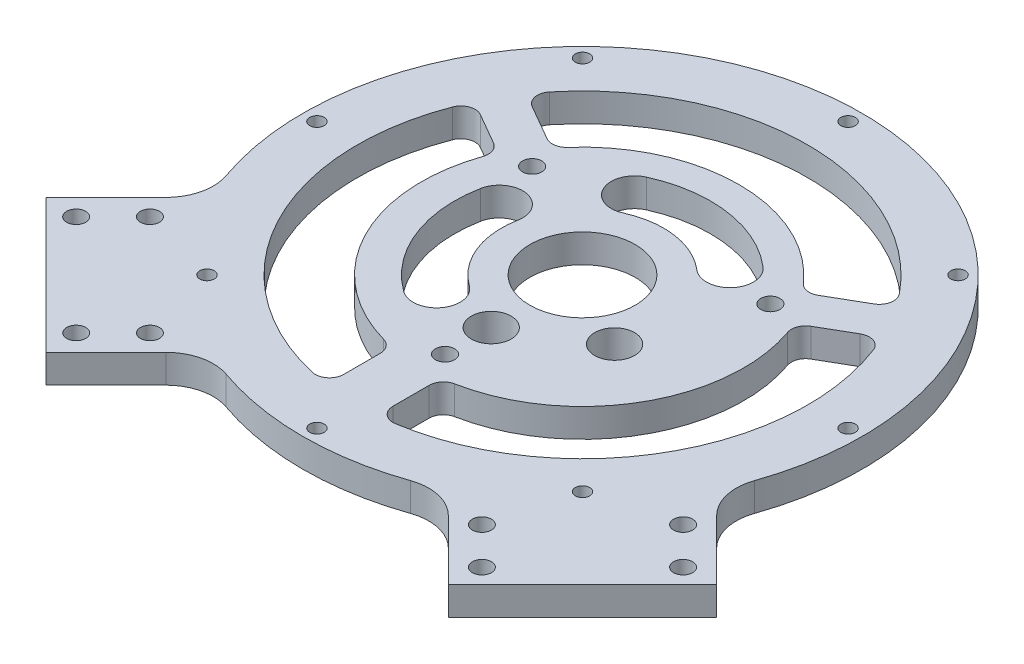
from build123d import *
from build123d.topology import SkipClean

# Parameters (mm, degrees)
SKETCH_1_R               = 59
SKETCH_1_R_2             = 11.1
EXTRUDE_1_DEPTH          = 6
SKETCH_2_R               = 1.525
CUT_EXTRUDE_1_DEPTH      = 6
EXTRUDE_START            = -6
EXTRUDE_2_DEPTH          = 6
SKETCH_4_R               = 4.2
SKETCH_4_R_2             = 2.025
CUT_EXTRUDE_2_DEPTH      = 6
SKETCH_5_R               = 4.2
CUT_EXTRUDE_3_DEPTH      = 6
CUT_EXTRUDE_4_DEPTH      = 10
CUT_EXTRUDE_5_DEPTH      = 10
CUT_EXTRUDE_7_DEPTH      = 10
FILLET_1_R               = 3
SKETCH_11_R              = 2.5
CUT_EXTRUDE_8_DEPTH      = 10
CUT_EXTRUDE_9_DEPTH      = 10
PATTERN_CIRCULAR_1_COUNT = 3
CUT_EXTRUDE_10_DEPTH     = 20
FILLET_3_R               = 20
FILLET_4_R               = 2
EXTRUDE_3_DEPTH          = 6
SKETCH_17_R              = 2.5
CUT_EXTRUDE_11_DEPTH     = 6
FILLET_5_R               = 20
EXTRUDE_4_DEPTH          = 6
MOVE_START               = -1
MOVE_FACE_1_OUTLINE_R    = 2.5
MOVE_FACE_1_DEPTH        = 8
MOVE_FACE_1_2_OUTLINE_R  = 2.5
MOVE_FACE_1_2_DEPTH      = 6
MOVE_FACE_2_OUTLINE_R    = 2.5
MOVE_FACE_2_DEPTH        = 8
MOVE_FACE_2_2_OUTLINE_R  = 2.5
MOVE_FACE_2_2_DEPTH      = 6
CUT_EXTRUDE_12_DEPTH     = 6
SKETCH_22_W              = 27
SKETCH_22_H              = 27
CUT_EXTRUDE_13_DEPTH     = 6
CHAMFER_1_SIZE           = 10
CHAMFER_1_SIZE_2         = 8.996196186
CHAMFER_2_SIZE           = 10
CHAMFER_3_SIZE           = 5
FILLET_6_R               = 5
FILLET_7_R               = 5
SKETCH_23_W              = 40
SKETCH_23_H              = 20
SKETCH_23_R              = 2.01
EXTRUDE_5_DEPTH          = 6
CUT_EXTRUDE_14_DEPTH     = 10
EXTRUDE_6_DEPTH          = 6
CUT_EXTRUDE_15_DEPTH     = 10
EXTRUDE_7_DEPTH          = 6
EXTRUDE_7_2_DEPTH        = 6
SKETCH_30_R              = 2.01
CUT_EXTRUDE_16_DEPTH     = 6
MOVE_BODY_2_ANGLE        = 90
EXTRUDE_9_DEPTH          = 6
FILLET_8_R               = 10


with BuildPart() as part:
    # 草图1 → 凸台-拉伸1 (new body)
    with BuildSketch(Plane(origin=(0, 0, 0), x_dir=(1, 0, 0), z_dir=(0, 1, 0))):
        with Locations(Location((0, 0, 0), (0, 0, 270))):
            Circle(SKETCH_1_R)
        with Locations(Location((0, 0, 0), (0, 0, 270))):
            Circle(SKETCH_1_R_2, mode=Mode.SUBTRACT)
    extrude(amount=EXTRUDE_1_DEPTH)

    # 草图2 → 切除-拉伸1 (cut)
    with BuildSketch(Plane(origin=(0, 6, 0), x_dir=(1, 0, 0), z_dir=(0, 1, 0))):
        with Locations(Location((0, 56, 0), (0, 0, 270))):
            Circle(SKETCH_2_R)
        with Locations(Location((39.597979746, 39.597979746, 0), (0, 0, 270))):
            Circle(SKETCH_2_R)
        with Locations(Location((56, 0, 0), (0, 0, 270))):
            Circle(SKETCH_2_R)
        with Locations(Location((39.597979746, -39.597979746, 0), (0, 0, 270))):
            Circle(SKETCH_2_R)
        with Locations(Location((0, -56, 0), (0, 0, 270))):
            Circle(SKETCH_2_R)
        with Locations(Location((-39.597979746, -39.597979746, 0), (0, 0, 270))):
            Circle(SKETCH_2_R)
        with Locations(Location((-56, 0, 0), (0, 0, 270))):
            Circle(SKETCH_2_R)
        with Locations(Location((-39.597979746, 39.597979746, 0), (0, 0, 270))):
            Circle(SKETCH_2_R)
    extrude(amount=-CUT_EXTRUDE_1_DEPTH, mode=Mode.SUBTRACT)

    # 草图3 → 凸台-拉伸2 (add)
    with BuildSketch(Plane(origin=(0, 6, 0), x_dir=(1, 0, 0), z_dir=(0, 1, 0)).offset(EXTRUDE_START)):
        with BuildLine():
            Line((-51.088050573, 29.512896989), (-22.5, 79))
            Line((-22.5, 79), (22.5, 79))
            Line((22.5, 79), (51.088050573, 29.512896989))
            ThreePointArc((51.088050573, 29.512896989), (0, 59), (-51.088050573, 29.512896989))
        make_face()
    extrude(amount=EXTRUDE_2_DEPTH)

    # 草图4 → 切除-拉伸2 (cut)
    with BuildSketch(Plane.XZ):
        with Locations(Location((0, 19.25, 0), (0, 0, 270))):
            Circle(SKETCH_4_R)
        with Locations(Location((0, 29, 0), (0, 0, 270))):
            Circle(SKETCH_4_R_2)
        with Locations(Location((25.11473671, -14.5, 0), (0, 0, 270))):
            Circle(SKETCH_4_R_2)
        with Locations(Location((-25.11473671, -14.5, 0), (0, 0, 270))):
            Circle(SKETCH_4_R_2)
    extrude(amount=-CUT_EXTRUDE_2_DEPTH, mode=Mode.SUBTRACT)

    # 草图5 → 切除-拉伸3 (cut)
    with BuildSketch(Plane.XZ):
        with Locations(Location((16.02146997, 9.25, 0), (0, 0, 270))):
            Circle(SKETCH_5_R)
    extrude(amount=-CUT_EXTRUDE_3_DEPTH, mode=Mode.SUBTRACT)

    # 草图8 → 切除-拉伸4 (cut)
    with BuildSketch(Plane.XZ):
        with BuildLine():
            Line((38.990090266, -27.129741264), (26.368115905, -19.842440969))
            ThreePointArc((26.368115905, -19.842440969), (0, -33), (-26.368115905, -19.842440969))
            Line((-26.368115905, -19.842440969), (-38.990090266, -27.129741264))
            ThreePointArc((-38.990090266, -27.129741264), (0, -47.5), (38.990090266, -27.129741264))
        make_face()
    extrude(amount=-CUT_EXTRUDE_4_DEPTH, mode=Mode.SUBTRACT)

    # 草图9 → 切除-拉伸5 (cut)
    with BuildSketch(Plane.XZ):
        with BuildLine():
            ThreePointArc((34, 0), (33.302950494, -6.849342188), (31.240383034, -13.417841401))
            Line((31.240383034, -13.417841401), (42.990090266, -20.201538034))
            ThreePointArc((42.990090266, -20.201538034), (46.35881409, -10.349413326), (47.5, 0))
            ThreePointArc((47.5, 0), (34.973204028, 32.142261899), (4, 47.331279298))
            Line((4, 47.331279298), (4, 33.763886032))
            ThreePointArc((4, 33.763886032), (25.416530054, 22.583179581), (34, 0))
        make_face()
    extrude(amount=-CUT_EXTRUDE_5_DEPTH, mode=Mode.SUBTRACT)

    # 草图10 → 切除-拉伸7 (cut)
    with BuildSketch(Plane.XZ):
        with BuildLine():
            Line((-42.990090266, -20.201538034), (-31.240383034, -13.417841401))
            ThreePointArc((-31.240383034, -13.417841401), (-30.175452448, 15.666590872), (-7, 33.271609519))
            Line((-7, 33.271609519), (-7, 46.98137929))
            ThreePointArc((-7, 46.98137929), (-41.870495295, 22.430149883), (-42.990090266, -20.201538034))
        make_face()
    extrude(amount=-CUT_EXTRUDE_7_DEPTH, mode=Mode.SUBTRACT)

    # 圆角1
    fillet_1_edges = [part.edges().sort_by_distance(p)[0] for p in [
        (42.990090266, 3, -20.201538034),
        (31.240383034, 3, -13.417841401),
        (4, 3, 33.763886032),
        (4, 3, 47.331279298),
        (-7, 3, 46.98137929),
        (-7, 3, 33.271609519),
        (-31.240383034, 3, -13.417841401),
        (-42.990090266, 3, -20.201538034),
        (-26.368115905, 3, -19.842440969),
        (26.368115905, 3, -19.842440969),
        (38.990090266, 3, -27.129741264),
        (-38.990090266, 3, -27.129741264),
    ]]
    fillet(fillet_1_edges, radius=FILLET_1_R)

    # 草图11 → 切除-拉伸8 (cut)
    with BuildSketch(Plane(origin=(0, 6, 0), x_dir=(1, 0, 0), z_dir=(0, 1, 0))):
        with Locations(Location((15, 63, 0), (0, 0, 270))):
            Circle(SKETCH_11_R)
        with Locations(Location((15, 74, 0), (0, 0, 270))):
            Circle(SKETCH_11_R)
        with Locations(Location((-15, 63, 0), (0, 0, 270))):
            Circle(SKETCH_11_R)
        with Locations(Location((-15, 74, 0), (0, 0, 270))):
            Circle(SKETCH_11_R)
    extrude(amount=-CUT_EXTRUDE_8_DEPTH, mode=Mode.SUBTRACT)

    # 草图12 → 切除-拉伸9 (cut)
    with BuildSketch(Plane.XZ):
        with BuildLine():
            ThreePointArc((-11.126662137, -24.600759941), (3.851051224, -26.723948145), (17.619884076, -20.458242475))
            ThreePointArc((17.619884076, -20.458242475), (18.140249782, -13.477252607), (11.159259915, -12.956886901))
            ThreePointArc((11.159259915, -12.956886901), (2.438999108, -16.925167159), (-7.04688602, -15.580481296))
            ThreePointArc((-7.04688602, -15.580481296), (-13.596913401, -18.05073256), (-11.126662137, -24.600759941))
        make_face()
    cut_extrude_9 = extrude(amount=-CUT_EXTRUDE_9_DEPTH, mode=Mode.SUBTRACT)

    # 阵列(圆周)1: 切除-拉伸9 ×3 about axis, 1 skipped
    pattern_circular_1_axis = Axis((0, 0, 0), (0, 1, 0))
    add([cut_extrude_9.rotate(pattern_circular_1_axis, i * 360 / PATTERN_CIRCULAR_1_COUNT) for i in range(1, PATTERN_CIRCULAR_1_COUNT) if i not in (2,)], mode=Mode.SUBTRACT)

    # 草图15 → 切除-拉伸10 (cut, symmetric)
    with BuildSketch(Plane.XZ):
        with BuildLine():
            Line((22.5, -79), (22.5, -69))
            Line((22.5, -69), (47.535137175, -34.948687153))
            ThreePointArc((47.535137175, -34.948687153), (49.386437856, -32.279711212), (51.088050573, -29.512896989))
            Line((51.088050573, -29.512896989), (22.5, -79))
        make_face()
        with BuildLine():
            Line((-22.5, -79), (-51.088050573, -29.512896989))
            ThreePointArc((-51.088050573, -29.512896989), (-49.386437856, -32.279711212), (-47.535137175, -34.948687153))
            Line((-47.535137175, -34.948687153), (-22.5, -69))
            Line((-22.5, -69), (-22.5, -79))
        make_face()
    extrude(amount=CUT_EXTRUDE_10_DEPTH, both=True, mode=Mode.SUBTRACT)

    # 圆角3
    fillet_3_edges = [part.edges().sort_by_distance(p)[0] for p in [
        (-22.5, 3, -69),
        (22.5, 3, -69),
    ]]
    fillet(fillet_3_edges, radius=FILLET_3_R)

    # 圆角4
    fillet_4_edges = [part.edges().sort_by_distance(p)[0] for p in [
        (-22.5, 3, -79),
        (22.5, 3, -79),
    ]]
    fillet(fillet_4_edges, radius=FILLET_4_R)

    # 草图16 → 凸台-拉伸3 (add)
    with BuildSketch(Plane.XZ):
        with BuildLine():
            ThreePointArc((-77, 22.5), (-78.414213562, 21.914213562), (-79, 20.5))
            Line((-79, 20.5), (-79, -20.5))
            ThreePointArc((-79, -20.5), (-78.414213562, -21.914213562), (-77, -22.5))
            Line((-77, -22.5), (-75.5609691, -22.5))
            ThreePointArc((-75.5609691, -22.5), (-69.326873995, -23.496419858), (-63.713956506, -26.386394178))
            Line((-63.713956506, -26.386394178), (-42.202213929, -42.202213929))
            Line((-42.202213929, -42.202213929), (-47.535137175, -34.948687153))
            ThreePointArc((-47.535137175, -34.948687153), (-58.324871521, 8.899964162), (-34.948687153, 47.535137175))
            Line((-34.948687153, 47.535137175), (-63.713956506, 26.386394178))
            ThreePointArc((-63.713956506, 26.386394178), (-69.326873995, 23.496419858), (-75.5609691, 22.5))
            Line((-75.5609691, 22.5), (-77, 22.5))
        make_face()
    extrude(amount=-EXTRUDE_3_DEPTH)

    # 草图17 → 切除-拉伸11 (cut)
    with BuildSketch(Plane.XZ):
        with Locations(Location((-74, -15, 0), (0, 0, 270))):
            Circle(SKETCH_17_R)
        with Locations(Location((-63, -15, 0), (0, 0, 270))):
            Circle(SKETCH_17_R)
        with Locations(Location((-74, 15, 0), (0, 0, 270))):
            Circle(SKETCH_17_R)
        with Locations(Location((-63, 15, 0), (0, 0, 270))):
            Circle(SKETCH_17_R)
    extrude(amount=-CUT_EXTRUDE_11_DEPTH, mode=Mode.SUBTRACT)

    # 圆角5
    fillet_5_edges = [part.edges().sort_by_distance(p)[0] for p in [
        (-42.202213929, 3, -42.202213929),
    ]]
    fillet(fillet_5_edges, radius=FILLET_5_R)

    # 草图20 → 凸台-拉伸4 (add)
    with BuildSketch(Plane.XZ.offset(EXTRUDE_START)):
        with BuildLine():
            ThreePointArc((-22.5, -77), (-21.914213562, -78.414213562), (-20.5, -79))
            Line((-20.5, -79), (-79, -79))
            Line((-79, -79), (-79, -20.5))
            ThreePointArc((-79, -20.5), (-78.414213562, -21.914213562), (-77, -22.5))
            Line((-77, -22.5), (-75.5609691, -22.5))
            ThreePointArc((-75.5609691, -22.5), (-69.326873995, -23.496419858), (-63.713956506, -26.386394178))
            Line((-63.713956506, -26.386394178), (-44.661036565, -40.394443337))
            ThreePointArc((-44.661036565, -40.394443337), (-42.365913536, -42.365913536), (-40.394443337, -44.661036565))
            Line((-40.394443337, -44.661036565), (-26.386394178, -63.713956506))
            ThreePointArc((-26.386394178, -63.713956506), (-23.496419858, -69.326873995), (-22.5, -75.5609691))
            Line((-22.5, -75.5609691), (-22.5, -77))
        make_face()
    extrude(amount=EXTRUDE_4_DEPTH)

    # Move Face 1: read off the stored shape, not the designer's step
    # Move Face 1 outline → Move Face 1 (cut)
    with BuildSketch(Plane(origin=(0, 0, 0), x_dir=(1, 0, 0), z_dir=(0, 1, 0)).offset(MOVE_START)):
        with Locations((-45, 74)):
            Circle(MOVE_FACE_1_OUTLINE_R)
        with Locations((-45, 63)):
            Circle(MOVE_FACE_1_OUTLINE_R)
    extrude(amount=MOVE_FACE_1_DEPTH, mode=Mode.SUBTRACT)

    # Move Face 1 2 outline → Move Face 1 2 (add)
    with BuildSketch(Plane(origin=(0, 0, 0), x_dir=(1, 0, 0), z_dir=(0, 1, 0))):
        with Locations((15, 63)):
            Circle(MOVE_FACE_1_2_OUTLINE_R)
        with Locations((15, 74)):
            Circle(MOVE_FACE_1_2_OUTLINE_R)
    extrude(amount=MOVE_FACE_1_2_DEPTH)

    # Move Face 2: read off the stored shape, not the designer's step
    # Move Face 2 outline → Move Face 2 (cut)
    with BuildSketch(Plane(origin=(0, 0, 0), x_dir=(1, 0, 0), z_dir=(0, 1, 0)).offset(MOVE_START)):
        with Locations((-63, 45)):
            Circle(MOVE_FACE_2_OUTLINE_R)
        with Locations((-74, 45)):
            Circle(MOVE_FACE_2_OUTLINE_R)
    extrude(amount=MOVE_FACE_2_DEPTH, mode=Mode.SUBTRACT)

    # Move Face 2 2 outline → Move Face 2 2 (add)
    with BuildSketch(Plane(origin=(0, 0, 0), x_dir=(1, 0, 0), z_dir=(0, 1, 0))):
        with Locations((-74, -15)):
            Circle(MOVE_FACE_2_2_OUTLINE_R)
        with Locations((-63, -15)):
            Circle(MOVE_FACE_2_2_OUTLINE_R)
    extrude(amount=MOVE_FACE_2_2_DEPTH)

    # 草图21 → 切除-拉伸12 (cut)
    with SkipClean():  # the faces are left unmerged after this step: merging them gives an invalid solid
        with BuildSketch(Plane.XZ):
            with BuildLine():
                Line((-79, 20.5), (-79, -7))
                Line((-79, -7), (-58.583274064, -7))
                ThreePointArc((-58.583274064, -7), (-54.134806169, 23.461090364), (-34.948687153, 47.535137175))
                Line((-34.948687153, 47.535137175), (-63.713956506, 26.386394178))
                ThreePointArc((-63.713956506, 26.386394178), (-69.326873995, 23.496419858), (-75.5609691, 22.5))
                Line((-75.5609691, 22.5), (-77, 22.5))
                ThreePointArc((-77, 22.5), (-78.414213562, 21.914213562), (-79, 20.5))
            make_face()
            with BuildLine():
                ThreePointArc((47.535137175, -34.948687153), (23.461090364, -54.134806169), (-7, -58.583274064))
                Line((-7, -58.583274064), (-7, -79))
                Line((-7, -79), (20.5, -79))
                ThreePointArc((20.5, -79), (21.914213562, -78.414213562), (22.5, -77))
                Line((22.5, -77), (22.5, -75.5609691))
                ThreePointArc((22.5, -75.5609691), (23.496419858, -69.326873995), (26.386394178, -63.713956506))
                Line((26.386394178, -63.713956506), (47.535137175, -34.948687153))
            make_face()
        extrude(amount=-CUT_EXTRUDE_12_DEPTH, mode=Mode.SUBTRACT)

    # 草图22 → 切除-拉伸13 (cut)
    with SkipClean():  # the faces are left unmerged after this step: merging them gives an invalid solid
        with BuildSketch(Plane.XZ):
            with Locations((-65.5, -65.5)):
                Rectangle(SKETCH_22_W, SKETCH_22_H)
        extrude(amount=-CUT_EXTRUDE_13_DEPTH, mode=Mode.SUBTRACT)

    # 倒角1
    # the kernel refuses this chamfer: 10, 8.996196186 mm, written as the material it adds along each edge
    with BuildSketch(Plane(origin=(-58.583274064, 0, -7), x_dir=(-0.03705222854815776, 0, 0.9993133304222529), z_dir=(0, 1, 0))) as chamfer_1_piece_1:
        with BuildLine():
            Line((9.649104907, 0), (CHAMFER_1_SIZE * 0.0370522285482, -CHAMFER_1_SIZE * 0.999313330422))
            Line((CHAMFER_1_SIZE * 0.0370522285482, -CHAMFER_1_SIZE * 0.999313330422), (0, 0))
            ThreePointArc((0, 0), (4.961434803, -0.197428902), (9.649104907, 0))
        make_face()
    extrude(amount=6)
    with BuildSketch(Plane(origin=(-7, 0, -58.583274064), x_dir=(0, 0, -1), z_dir=(0, 1, 0))) as chamfer_1_piece_2:
        with BuildLine():
            Line((CHAMFER_1_SIZE_2, 0), (0.274910204, -11.088293621))
            ThreePointArc((0.274910204, -11.088293621), (0.402241702, -5.692739545), (0, 0))
            Line((0, 0), (CHAMFER_1_SIZE_2, 0))
        make_face()
    extrude(amount=6)

    # 倒角2
    chamfer_2_edges = [part.edges().sort_by_distance(p)[0] for p in [
        (-52, 3, -52),
    ]]
    chamfer(chamfer_2_edges, length=CHAMFER_2_SIZE)

    # 倒角3
    chamfer_3_edges = [part.edges().sort_by_distance(p)[0] for p in [
        (-79, 3, -7),
        (-7, 3, -79),
        (-52, 3, -79),
        (-79, 3, -52),
    ]]
    chamfer(chamfer_3_edges, length=CHAMFER_3_SIZE)

    # 圆角6
    fillet_6_edges = [part.edges().sort_by_distance(p)[0] for p in [
        (-62, 3, -52),
        (-52, 3, -62),
    ]]
    fillet(fillet_6_edges, radius=FILLET_6_R)

    # 圆角7
    fillet_7_edges = [part.edges().sort_by_distance(p)[0] for p in [
        (-7, 3, -67.57947025),
        (-58.940794904, 3, 2.64247916),
        (4.088293621, 3, -58.858184268),
        (-68.583274064, 3, -7),
    ]]
    fillet(fillet_7_edges, radius=FILLET_7_R)

    # 草图23 → 凸台-拉伸5 (add)
    # profile 1 of 2: a face of its own
    with BuildSketch(Plane(origin=(0, 6, 0), x_dir=(1, 0, 0), z_dir=(0, 1, 0)).offset(EXTRUDE_START)):
        with BuildLine():
            Line((57, 59), (25, 59))
            Line((25, 59), (4.342510776, 59))
            ThreePointArc((4.342510776, 59), (4.927450513, 58.834106383), (5.528201143, 58.740437453))
            ThreePointArc((5.528201143, 58.740437453), (38.088054411, 45.058851641), (57, 15.231546212))
            Line((57, 15.231546212), (57, 59))
        make_face()
    # profile 2 of 2: a face of its own
    with BuildSketch(Plane(origin=(0, 6, 0), x_dir=(1, 0, 0), z_dir=(0, 1, 0)).offset(EXTRUDE_START)):
        with Locations((45, 69)):
            Rectangle(SKETCH_23_W, SKETCH_23_H)
        with Locations(Location((60, 64, 0), (0, 0, 270))):
            Circle(SKETCH_23_R, mode=Mode.SUBTRACT)
        with Locations(Location((30, 64, 0), (0, 0, 270))):
            Circle(SKETCH_23_R, mode=Mode.SUBTRACT)
        with Locations(Location((30, 75, 0), (0, 0, 270))):
            Circle(SKETCH_23_R, mode=Mode.SUBTRACT)
        with Locations(Location((60, 75, 0), (0, 0, 270))):
            Circle(SKETCH_23_R, mode=Mode.SUBTRACT)
    extrude_5 = extrude(amount=EXTRUDE_5_DEPTH)

    # 镜向1: 凸台-拉伸5 across plane
    add(extrude_5.mirror(Plane(origin=(0, 0, 0), x_dir=(0.7071067811865478, 0, 0.7071067811865472), z_dir=(-0.7071067811865475, 0, 0.7071067811865477))))

    # 草图25 → 切除-拉伸14 (cut)
    with BuildSketch(Plane(origin=(0, 6, 0), x_dir=(1, 0, 0), z_dir=(0, 1, 0))):
        with BuildLine():
            Line((0, 59), (4.342510776, 59))
            ThreePointArc((4.342510776, 59), (3.591531067, 59.334926374), (2.905600995, 59.788408608))
            Line((2.905600995, 59.788408608), (-5.09109177, 66.078054869))
            ThreePointArc((-5.09109177, 66.078054869), (-6.497524811, 67.82353417), (-7, 70.008086888))
            Line((-7, 70.008086888), (-7, 74))
            Line((-7, 74), (-12, 79))
            Line((-12, 79), (-47, 79))
            Line((-47, 79), (-52, 74))
            Line((-52, 74), (-52, 64.071067812))
            ThreePointArc((-52, 64.071067812), (-52.380602337, 62.15765065), (-53.464466094, 60.535533906))
            Line((-53.464466094, 60.535533906), (-60.535533906, 53.464466094))
            ThreePointArc((-60.535533906, 53.464466094), (-62.15765065, 52.380602337), (-64.071067812, 52))
            Line((-64.071067812, 52), (-74, 52))
            Line((-74, 52), (-79, 47))
            Line((-79, 47), (-79, 12))
            Line((-79, 12), (-74, 7))
            Line((-74, 7), (-70.654341875, 7))
            ThreePointArc((-70.654341875, 7), (-68.740924714, 6.619397663), (-67.118807969, 5.535533906))
            Line((-67.118807969, 5.535533906), (-60.281386699, -1.301887365))
            ThreePointArc((-60.281386699, -1.301887365), (-59.273192013, -2.750670092), (-58.831223682, -4.459497734))
            ThreePointArc((-58.831223682, -4.459497734), (-43.267253011, 40.111654377), (0, 59))
        make_face()
    extrude(amount=-CUT_EXTRUDE_14_DEPTH, mode=Mode.SUBTRACT)

    # 草图26 → 凸台-拉伸6 (add)
    with BuildSketch(Plane(origin=(0, 6, 0), x_dir=(1, 0, 0), z_dir=(0, 1, 0)).offset(EXTRUDE_START)):
        with BuildLine():
            Line((-59, 0), (-59, -4.342510776))
            ThreePointArc((-59, -4.342510776), (-58.834106383, -4.927450513), (-58.740437453, -5.528201143))
            ThreePointArc((-58.740437453, -5.528201143), (-58.935073639, -2.767145668), (-59, 0))
        make_face()
    extrude(amount=EXTRUDE_6_DEPTH)

    # 草图27 → 切除-拉伸15 (cut)
    with BuildSketch(Plane(origin=(0, 6, 0), x_dir=(1, 0, 0), z_dir=(0, 1, 0))):
        with BuildLine():
            Line((-59, 0), (-59, -25))
            Line((-59, -25), (-59, -57))
            Line((-59, -57), (-15.231546212, -57))
            ThreePointArc((-15.231546212, -57), (-46.795626005, -35.932845514), (-59, 0))
        make_face()
        with BuildLine():
            Line((25, 59), (0, 59))
            ThreePointArc((0, 59), (35.932845514, 46.795626005), (57, 15.231546212))
            Line((57, 15.231546212), (57, 59))
            Line((57, 59), (25, 59))
        make_face()
    extrude(amount=-CUT_EXTRUDE_15_DEPTH, mode=Mode.SUBTRACT)


with BuildPart() as cut_extrude_15_kept_piece:
    # of the separate pieces the step leaves, the one the design keeps (cut_extrude_15_pieces_kept)
    add(part.part.solids().sort_by_distance((0, 0, -59))[0])



with BuildPart() as body_2:
    # 草图29 → 凸台-拉伸7 (new body)
    with BuildSketch(Plane(origin=(0, 6, 0), x_dir=(1, 0, 0), z_dir=(0, 1, 0))):
        Polygon((56.568542495, 28.284271247), (28.284271247, 56.568542495), (42.426406871, 70.710678119), (70.710678119, 42.426406871), align=None)
    extrude(amount=-EXTRUDE_7_DEPTH)


with BuildPart() as body_3:
    # 草图29 → Extrude 7 2 (new body)
    with BuildSketch(Plane(origin=(0, 6, 0), x_dir=(1, 0, 0), z_dir=(0, 1, 0))):
        Polygon((-28.284271247, -56.568542495), (-56.568542495, -28.284271247), (-70.710678119, -42.426406871), (-42.426406871, -70.710678119), align=None)
    extrude(amount=-EXTRUDE_7_2_DEPTH)


with BuildPart() as cut_extrude_16_tool:
    # 草图30 → 切除-拉伸16 (new body)
    with BuildSketch(Plane(origin=(0, 6, 0), x_dir=(1, 0, 0), z_dir=(0, 1, 0))):
        with Locations(Location((63.993163697, 42.779960262, 0), (0, 0, 270))):
            Circle(SKETCH_30_R)
        with Locations(Location((42.779960262, 63.993163697, 0), (0, 0, 270))):
            Circle(SKETCH_30_R)
        with Locations(Location((35.001785669, 56.214989104, 0), (0, 0, 270))):
            Circle(SKETCH_30_R)
        with Locations(Location((56.214989104, 35.001785669, 0), (0, 0, 270))):
            Circle(SKETCH_30_R)
        with Locations(Location((-63.993163697, -42.779960262, 0), (0, 0, 270))):
            Circle(SKETCH_30_R)
        with Locations(Location((-56.214989104, -35.001785669, 0), (0, 0, 270))):
            Circle(SKETCH_30_R)
        with Locations(Location((-35.001785669, -56.214989104, 0), (0, 0, 270))):
            Circle(SKETCH_30_R)
        with Locations(Location((-42.779960262, -63.993163697, 0), (0, 0, 270))):
            Circle(SKETCH_30_R)
    extrude(amount=-CUT_EXTRUDE_16_DEPTH)


with BuildPart() as body_2_1:
    add(body_2.part)

    # 切除-拉伸16: cut by cut_extrude_16_tool
    add(cut_extrude_16_tool.part, mode=Mode.SUBTRACT)


with BuildPart() as body_3_1:
    add(body_3.part)

    # 切除-拉伸16: cut by cut_extrude_16_tool
    add(cut_extrude_16_tool.part, mode=Mode.SUBTRACT)


with BuildPart() as body_2_2:
    # Move Body 2: moved
    add(body_2_1.part.rotate(Axis((0, 0, 0), (0, -1, 0)), MOVE_BODY_2_ANGLE))


with BuildPart() as cut_extrude_15_kept_piece_1:
    add(cut_extrude_15_kept_piece.part)

    add(body_2_2.part)  # 凸台-拉伸9 merges body 2

    add(body_3_1.part)  # 凸台-拉伸9 merges body 3
    # 草图35 → 凸台-拉伸9 (add)
    with BuildSketch(Plane(origin=(0, 6, 0), x_dir=(1, 0, 0), z_dir=(0, 1, 0))):
        with BuildLine():
            Line((-56.568542495, -28.284271247), (-53.391339437, -25.10706819))
            ThreePointArc((-53.391339437, -25.10706819), (-41.71930009, -41.71930009), (-25.10706819, -53.391339437))
            Line((-25.10706819, -53.391339437), (-28.284271247, -56.568542495))
            Line((-28.284271247, -56.568542495), (-56.568542495, -28.284271247))
        make_face()
        with BuildLine():
            Line((28.284271247, -56.568542495), (56.568542495, -28.284271247))
            Line((56.568542495, -28.284271247), (53.391339437, -25.10706819))
            ThreePointArc((53.391339437, -25.10706819), (41.71930009, -41.71930009), (25.10706819, -53.391339437))
            Line((25.10706819, -53.391339437), (28.284271247, -56.568542495))
        make_face()
    extrude(amount=-EXTRUDE_9_DEPTH)

    # 圆角8
    fillet_8_edges = [cut_extrude_15_kept_piece_1.edges().sort_by_distance(p)[0] for p in [
        (-53.391339437, 3, 25.10706819),
        (-25.10706819, 3, 53.391339437),
        (25.10706819, 3, 53.391339437),
        (53.391339437, 3, 25.10706819),
    ]]
    fillet(fillet_8_edges, radius=FILLET_8_R)


solid = cut_extrude_15_kept_piece_1.part
